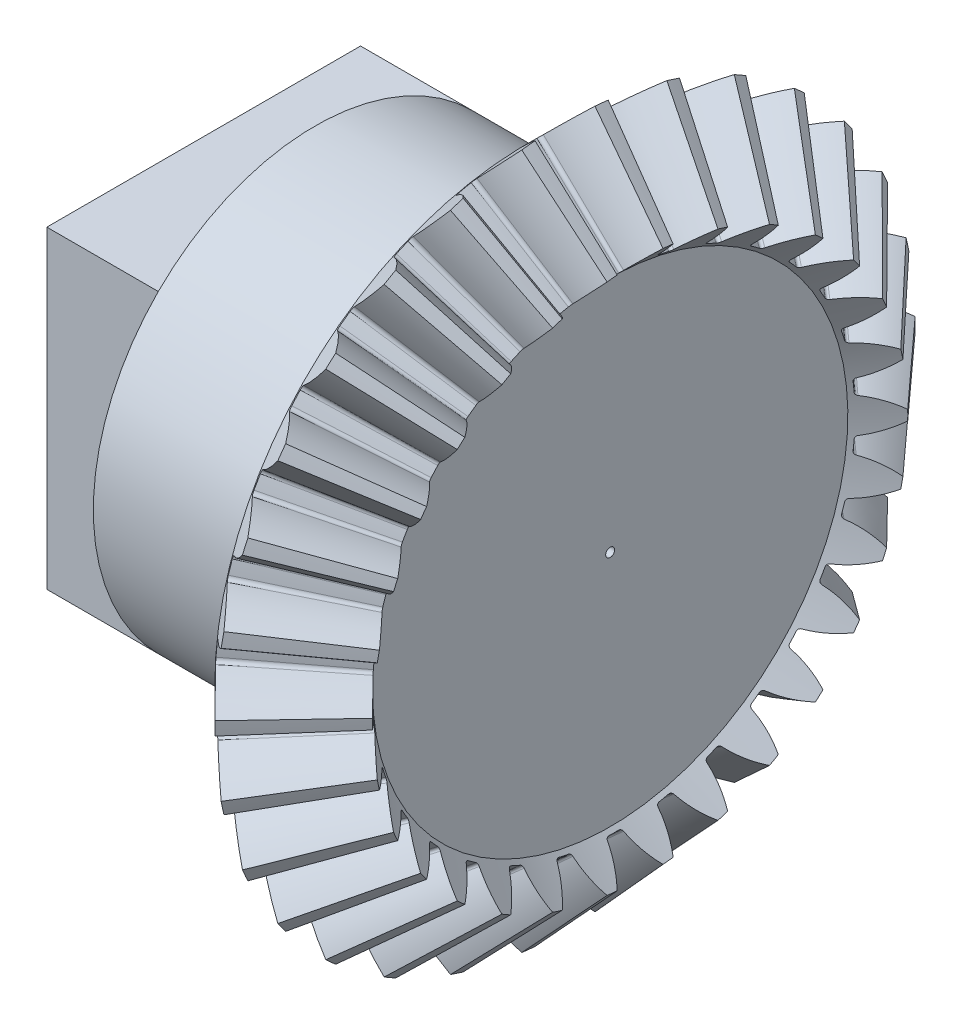
from build123d import *

# Parameters (mm, degrees)
TEETHCUTS_COUNT     = 30
TEETHCUTS_ANGLE     = 348
HUBSKE_R            = 27.899008976
HUB_DEPTH           = 17.899110576
BORSKE_R            = 0.4
BORE_DEPTH          = 50.0000508
SKETCH1_R           = 30
SKETCH1_R_2         = 8.5
CUT_EXTRUDE1_DEPTH  = 18
SKETCH2_R           = 19.9
BOSS_EXTRUDE1_DEPTH = 29
SKETCH3_R           = 22
BOSS_EXTRUDE2_DEPTH = 2.8
CUT_EXTRUDE2_START  = -10
CUT_EXTRUDE2_DEPTH  = 10


with BuildPart() as part:
    # BasProSke → Base-Revolve (revolve)
    with BuildSketch(Plane(origin=(0, 0, 0), x_dir=(1, 0, 0), z_dir=(0, 1, 0)), mode=Mode.PRIVATE) as base_revolve_sk:
        Polygon((0, 0), (0, 27.899008978), (3.515204589, 31.414213561), (10.252939061, 24.00981241), (7.56627614, 21.323149493), (7.56627614, 0), align=None)
    revolve(base_revolve_sk.sketch.rotate(Axis((-10, 0, 0), (1, 0, 0)), 180), axis=Axis((-10, 0, 0), (1, 0, 0)))

    # ToothCut: read off the stored shape, not the designer's step
    # ToothCut: loft between two sections, ruled curve by curve
    toothcut_from = [
        Edge.make_bspline([(32.107368446, 0.00637742, -0.008941272), (32.103007485, 0.00201646, -0.015162265), (32.096845425, -0.0041456, -0.01427078), (32.093465486, -0.00752554, -0.006929886)], [0, 0, 0, 0, 1, 1, 1, 1], 3, [1, 0.752073194, 0.752073194, 1]),
        Edge.make_bspline([(32.093465486, -0.00752554, 0.006929886), (32.096845425, -0.0041456, 0.01427078), (32.103007485, 0.00201646, 0.015162265), (32.107368446, 0.00637742, 0.008941272)], [0, 0, 0, 0, 1, 1, 1, 1], 3, [1, 0.752073194, 0.752073194, 1]),
        Edge.make_bspline([(32.093465486, -0.00752554, -0.006929886), (32.0930377, -0.007953325, -0.006000777), (32.092699099, -0.008291926, -0.005000806), (32.092455449, -0.008535577, -0.003946997)], [0, 0, 0, 0, 1, 1, 1, 1], 3, [1, 0.994324543, 0.994324543, 1]),
        Edge.make_bspline([(32.092455449, -0.008535577, 0.003946997), (32.092699099, -0.008291926, 0.005000806), (32.0930377, -0.007953325, 0.006000777), (32.093465486, -0.00752554, 0.006929886)], [0, 0, 0, 0, 1, 1, 1, 1], 3, [1, 0.994324543, 0.994324543, 1]),
        Edge.make_bspline([(32.092455449, -0.008535577, -0.003946997), (32.091857446, -0.009133579, -0.001360583), (32.091857446, -0.009133579, 0.001360583), (32.092455449, -0.008535577, 0.003946997)], [0, 0, 0, 0, 1, 1, 1, 1], 3, [1, 0.966986355, 0.966986355, 1]),
        Edge.make_line((32.107368446, 0.00637742, 0.008941272), (32.107368446, 0.00637742, -0.008941272)),
    ]
    toothcut_to = [
        Edge.make_bspline([(3.863106025, 31.762114997, -3.1046877), (2.900203726, 30.7992127, -2.06288016), (1.803489856, 29.702498831, -1.332016289), (0.622394669, 28.521403646, -0.945037029)], [0, 0, 0, 0, 1, 1, 1, 1], 3, [1, 0.984976253, 0.984976253, 1]),
        Edge.make_bspline([(0.622394669, 28.521403646, 0.945037029), (1.803489856, 29.702498831, 1.332016289), (2.900203726, 30.7992127, 2.06288016), (3.863106025, 31.762114997, 3.1046877)], [0, 0, 0, 0, 1, 1, 1, 1], 3, [1, 0.984976253, 0.984976253, 1]),
        Edge.make_bspline([(0.622394669, 28.521403646, -0.945037029), (0.494159042, 28.39316802, -0.90302134), (0.413323338, 28.312332315, -0.756102152), (0.416039497, 28.315048475, -0.56998575)], [0, 0, 0, 0, 1, 1, 1, 1], 3, [1, 0.850924202, 0.850924202, 1]),
        Edge.make_bspline([(0.416039497, 28.315048475, 0.56998575), (0.413323338, 28.312332315, 0.756102152), (0.494159042, 28.39316802, 0.90302134), (0.622394669, 28.521403646, 0.945037029)], [0, 0, 0, 0, 1, 1, 1, 1], 3, [1, 0.850924202, 0.850924202, 1]),
        Edge.make_bspline([(0.416039497, 28.315048475, -0.56998575), (0.421584638, 28.320593615, -0.190022222), (0.421584638, 28.320593615, 0.190022222), (0.416039497, 28.315048475, 0.56998575)], [0, 0, 0, 0, 1, 1, 1, 1], 3, [1, 0.999858058, 0.999858058, 1]),
        Edge.make_line((3.863106025, 31.762114997, 3.1046877), (3.863106025, 31.762114997, -3.1046877)),
    ]
    toothcut = Solid(Shell([*[Face.make_surface_from_curves(toothcut_from[k], toothcut_to[k]) for k in range(6)], Face(Wire(toothcut_from)), Face(Wire(toothcut_to))]))
    add(toothcut, mode=Mode.SUBTRACT)

    # TeethCuts: ToothCut ×30 about axis
    teethcuts_axis = Axis((-10, 0, 0), (1, 0, 0))
    for i in range(1, TEETHCUTS_COUNT):
        add(toothcut.rotate(teethcuts_axis, i * TEETHCUTS_ANGLE / (TEETHCUTS_COUNT - 1)), mode=Mode.SUBTRACT)

    # HubSke → Hub (add)
    with BuildSketch(Plane.ZY):
        Circle(HUBSKE_R)
    extrude(amount=HUB_DEPTH)

    # BorSke → Bore (cut, symmetric)
    with BuildSketch(Plane(origin=(0, 0, 0), x_dir=(0, 0, -1), z_dir=(1, 0, 0))):
        with Locations(Location((0, 0, 0), (0, 0, 180))):
            Circle(BORSKE_R)
    extrude(amount=BORE_DEPTH, both=True, mode=Mode.SUBTRACT)

    # Sketch1 → Cut-Extrude1 (cut)
    with BuildSketch(Plane.ZY.offset(17.899110576)):
        Circle(SKETCH1_R)
        Circle(SKETCH1_R_2, mode=Mode.SUBTRACT)
    extrude(amount=-CUT_EXTRUDE1_DEPTH, mode=Mode.SUBTRACT)

    # Sketch2 → Boss-Extrude1 (add)
    with BuildSketch(Plane.ZY.offset(-0.100889424)):
        with Locations(Location((0, 0, 0), (0, 0, 180))):
            Circle(SKETCH2_R)
    extrude(amount=BOSS_EXTRUDE1_DEPTH)

    # Sketch3 → Boss-Extrude2 (add)
    with BuildSketch(Plane.ZY.offset(-0.100889424)):
        Circle(SKETCH3_R)
    extrude(amount=BOSS_EXTRUDE2_DEPTH)

    # Sketch4 → Cut-Extrude2 (cut)
    with BuildSketch(Plane.ZY.offset(28.899110576).offset(CUT_EXTRUDE2_START)):
        with BuildLine():
            ThreePointArc((14.071424946, 14.071424946), (0, 19.9), (-14.071424946, 14.071424946))
            Line((-14.071424946, 14.071424946), (14.071424946, 14.071424946))
        make_face()
        with BuildLine():
            Line((14.071424946, 14.071424946), (14.071424946, -14.071424946))
            ThreePointArc((14.071424946, -14.071424946), (18.385202697, -7.615400304), (19.9, 0))
            ThreePointArc((19.9, 0), (18.385202697, 7.615400304), (14.071424946, 14.071424946))
        make_face()
        with BuildLine():
            Line((14.071424946, -14.071424946), (-14.071424946, -14.071424946))
            ThreePointArc((-14.071424946, -14.071424946), (0, -19.9), (14.071424946, -14.071424946))
        make_face()
        with BuildLine():
            ThreePointArc((-14.071424946, 14.071424946), (-19.9, 0), (-14.071424946, -14.071424946))
            Line((-14.071424946, -14.071424946), (-14.071424946, 14.071424946))
        make_face()
    extrude(amount=CUT_EXTRUDE2_DEPTH, mode=Mode.SUBTRACT)


solid = part.part
